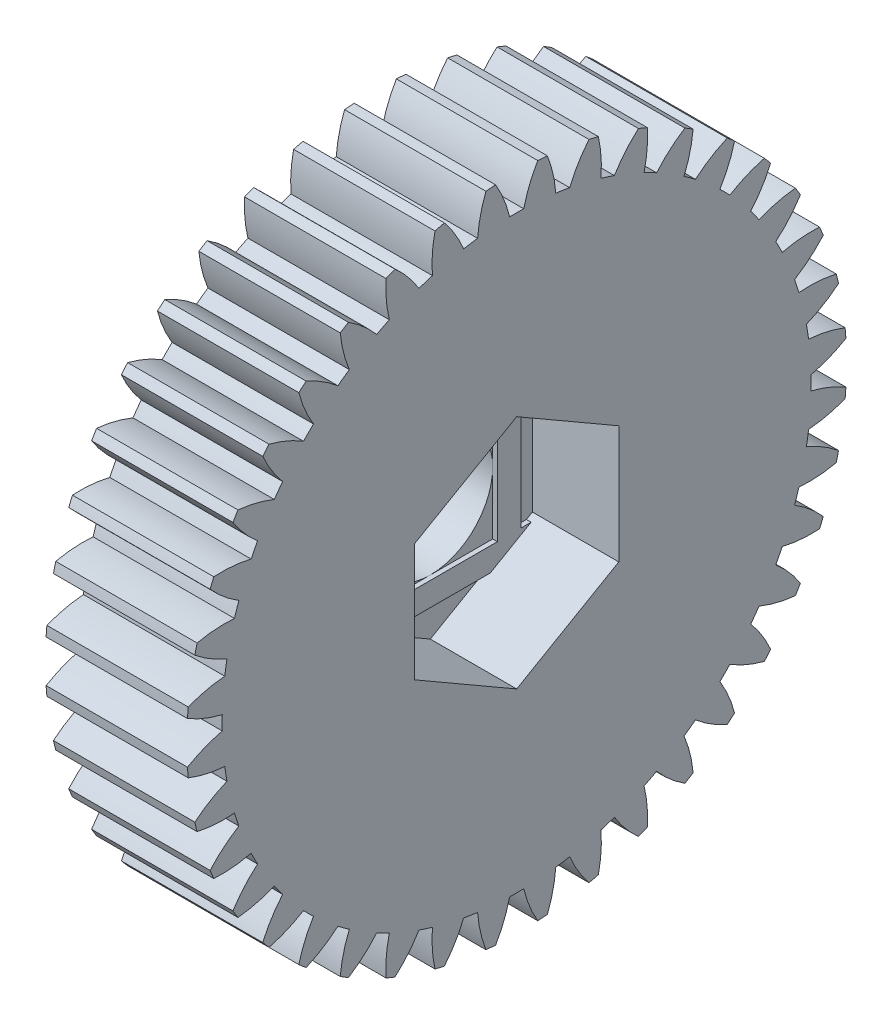
from build123d import *

# Parameters (mm, degrees)
BASPROSKE_W         = 9
BASPROSKE_H         = 21
TOOTHCUT_DEPTH      = 32.032241298
TEETHCUTS_COUNT     = 40
TEETHCUTS_ANGLE     = 351
BORSKE_R            = 2
BORE_DEPTH          = 50.0000508
CUT_EXTRUDE1_DEPTH  = 5.5
SKETCH1_7_R         = 3.9725
CUT_EXTRUDE2_DEPTH  = 31.974304622
SKETCH2_R           = 6
SKETCH2_R_2         = 4
BOSS_EXTRUDE1_DEPTH = 2.3
SKETCH3_W           = 7.945
SKETCH3_H           = 7.945
BOSS_EXTRUDE2_DEPTH = 0.3


with BuildPart() as part:
    # BasProSke → Base-Revolve (revolve)
    with BuildSketch(Plane(origin=(0, 0, 0), x_dir=(1, 0, 0), z_dir=(0, 1, 0))):
        with Locations((4.5, 10.5)):
            Rectangle(BASPROSKE_W, BASPROSKE_H)
    revolve(axis=Axis((-10, 0, 0), (1, 0, 0)))

    # TooCutSke → ToothCut (cut, through all)
    with BuildSketch(Plane(origin=(0, 0, 0), x_dir=(0, 0, -1), z_dir=(1, 0, 0))):
        with BuildLine():
            ThreePointArc((0.448673268, 18.74363074), (0, 18.749), (-0.448673268, 18.74363074))
            ThreePointArc((-0.448673268, 18.74363074), (-0.816786816, 19.89705013), (-1.354745081, 20.981708961))
            ThreePointArc((-1.354745081, 20.981708961), (0, 21.0254), (1.354745081, 20.981708961))
            ThreePointArc((1.354745081, 20.981708961), (0.816786816, 19.89705013), (0.448673268, 18.74363074))
        make_face()
    toothcut = extrude(amount=TOOTHCUT_DEPTH, mode=Mode.SUBTRACT)

    # TeethCuts: ToothCut ×40 about axis
    teethcuts_axis = Axis((-10, 0, 0), (1, 0, 0))
    for i in range(1, TEETHCUTS_COUNT):
        add(toothcut.rotate(teethcuts_axis, i * TEETHCUTS_ANGLE / (TEETHCUTS_COUNT - 1)), mode=Mode.SUBTRACT)

    # BorSke → Bore (cut, symmetric)
    with BuildSketch(Plane(origin=(0, 0, 0), x_dir=(0, 0, -1), z_dir=(1, 0, 0))):
        Circle(BORSKE_R)
    extrude(amount=BORE_DEPTH, both=True, mode=Mode.SUBTRACT)

    # Sketch1 → Cut-Extrude1 (cut)
    with BuildSketch(Plane(origin=(9, 0, 0), x_dir=(0, 0, -1), z_dir=(1, 0, 0))):
        Polygon((0, 7.505553499), (-6.5, 3.75277675), (-6.5, -3.75277675), (0, -7.505553499), (6.5, -3.75277675), (6.5, 3.75277675), align=None)
    extrude(amount=-CUT_EXTRUDE1_DEPTH, mode=Mode.SUBTRACT)

    # Sketch1<7> → Cut-Extrude2 (cut, through all)
    with BuildSketch(Plane(origin=(9, 0, 0), x_dir=(0, 0, -1), z_dir=(1, 0, 0))):
        Circle(SKETCH1_7_R)
    extrude(amount=-CUT_EXTRUDE2_DEPTH, mode=Mode.SUBTRACT)

    # Sketch2 → Boss-Extrude1 (add)
    with BuildSketch(Plane.ZY):
        Circle(SKETCH2_R)
        Circle(SKETCH2_R_2, mode=Mode.SUBTRACT)
    extrude(amount=BOSS_EXTRUDE1_DEPTH)

    # Sketch3 → Boss-Extrude2 (add)
    with BuildSketch(Plane(origin=(3.5, 0, 0), x_dir=(0, 0, -1), z_dir=(1, 0, 0))):
        Polygon((5.4725, -3.9725), (5.4725, 3.9725), (6.119428167, 3.9725), (3.521351956, 5.4725), (-3.521351956, 5.4725), (-6.119428167, 3.9725), (-5.4725, 3.9725), (-5.4725, -3.9725), (-6.119428167, -3.9725), (-3.521351956, -5.4725), (3.521351956, -5.4725), (6.119428167, -3.9725), align=None)
        Rectangle(SKETCH3_W, SKETCH3_H, mode=Mode.SUBTRACT)
    extrude(amount=BOSS_EXTRUDE2_DEPTH)


solid = part.part
